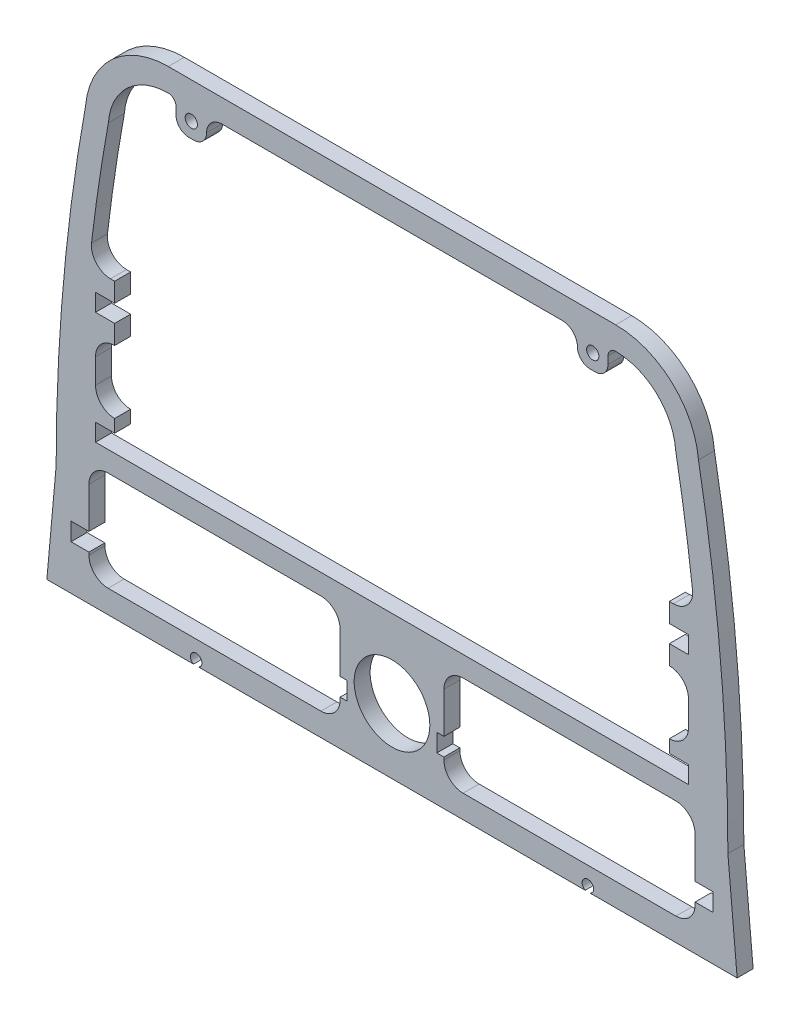
from build123d import *

# Parameters (mm, degrees)
SKETCH1_R           = 3.7592
SKETCH1_R_2         = 0.6096
BOSS_EXTRUDE1_DEPTH = 1.5875
FILLET1_R           = 1.905
FILLET2_R           = 1.905


with BuildPart() as part:
    # Sketch1 → Boss-Extrude1 (new body)
    with BuildSketch(Plane.XY):
        with BuildLine():
            Line((34.29, -22.225), (33.367605666, -11.9888))
            ThreePointArc((33.367605666, -11.9888), (32.635899737, 4.284200971), (30.44668746, 20.425864572))
            ThreePointArc((30.44668746, 20.425864572), (27.794074787, 25.778474462), (22.225, 27.94))
            Line((22.225, 27.94), (-22.225, 27.94))
            ThreePointArc((-22.225, 27.94), (-27.794074787, 25.778474462), (-30.44668746, 20.425864572))
            ThreePointArc((-30.44668746, 20.425864572), (-32.635899737, 4.284200971), (-33.367605666, -11.9888))
            Line((-33.367605666, -11.9888), (-34.29, -22.225))
            Line((-34.29, -22.225), (-19.719346062, -22.225))
            ThreePointArc((-19.719346062, -22.225), (-19.755004666, -21.229024189), (-18.886028855, -21.717))
            ThreePointArc((-18.886028855, -21.717), (-18.969553044, -22.014475811), (-19.195711648, -22.225))
            Line((-19.195711648, -22.225), (19.195711648, -22.225))
            ThreePointArc((19.195711648, -22.225), (19.160053044, -21.229024189), (20.029028855, -21.717))
            ThreePointArc((20.029028855, -21.717), (19.945504666, -22.014475811), (19.719346062, -22.225))
            Line((19.719346062, -22.225), (34.29, -22.225))
        make_face()
        Polygon((-5.1562, -19.939), (-30.110080889, -19.939), (-30.110080889, -17.78), (-31.888080889, -17.78), (-31.888080889, -16.002), (-30.110080889, -16.002), (-30.110080889, -10.033), (-5.1562, -10.033), (-5.1562, -16.002), (-4.456080889, -16.002), (-4.456080889, -17.78), (-5.1562, -17.78), align=None, mode=Mode.SUBTRACT)
        with Locations((0, -15.748)):
            Circle(SKETCH1_R, mode=Mode.SUBTRACT)
        Polygon((5.1562, -19.939), (5.1562, -17.78), (4.456080889, -17.78), (4.456080889, -16.002), (5.1562, -16.002), (5.1562, -10.033), (30.110080889, -10.033), (30.110080889, -16.002), (31.888080889, -16.002), (31.888080889, -17.78), (30.110080889, -17.78), (30.110080889, -19.939), align=None, mode=Mode.SUBTRACT)
        with BuildLine():
            Line((-16.907947674, 25.654), (16.907947674, 25.654))
            ThreePointArc((16.907947674, 25.654), (17.978031977, 25.210756569), (18.421275408, 24.140672267))
            Line((18.421275408, 24.140672267), (18.421275408, 24.136275408))
            ThreePointArc((18.421275408, 24.136275408), (18.793249795, 23.238249795), (19.691275408, 22.866275408))
            Line((19.691275408, 22.866275408), (20.186724592, 22.866275408))
            ThreePointArc((20.186724592, 22.866275408), (21.084750205, 23.238249795), (21.456724592, 24.136275408))
            Line((21.456724592, 24.136275408), (21.456724592, 24.871259676))
            ThreePointArc((21.456724592, 24.871259676), (21.686749328, 25.425496663), (22.24162483, 25.653976848))
            ThreePointArc((22.24162483, 25.653976848), (26.292824304, 24.053268127), (28.177671702, 20.126203591))
            ThreePointArc((28.177671702, 20.126203591), (29.260117929, 13.484694907), (30.092217203, 6.8072))
            Line((30.092217203, 6.8072), (27.552217203, 6.8072))
            Line((27.552217203, 6.8072), (27.552217203, 4.9022))
            Line((27.552217203, 4.9022), (29.457217203, 4.9022))
            Line((29.457217203, 4.9022), (29.457217203, 3.175))
            Line((29.457217203, 3.175), (27.552217203, 3.175))
            Line((27.552217203, 3.175), (27.552217203, 1.27))
            Line((27.552217203, 1.27), (29.457217203, 1.27))
            Line((29.457217203, 1.27), (29.457217203, -5.0038))
            Line((29.457217203, -5.0038), (27.552217203, -5.0038))
            Line((27.552217203, -5.0038), (27.552217203, -6.2738))
            Line((27.552217203, -6.2738), (29.457217203, -6.2738))
            Line((29.457217203, -6.2738), (29.457217203, -8.001))
            Line((29.457217203, -8.001), (-29.457217203, -8.001))
            Line((-29.457217203, -8.001), (-29.457217203, -6.2738))
            Line((-29.457217203, -6.2738), (-27.552217203, -6.2738))
            Line((-27.552217203, -6.2738), (-27.552217203, -5.0038))
            Line((-27.552217203, -5.0038), (-29.457217203, -5.0038))
            Line((-29.457217203, -5.0038), (-29.457217203, 1.27))
            Line((-29.457217203, 1.27), (-27.552217203, 1.27))
            Line((-27.552217203, 1.27), (-27.552217203, 3.175))
            Line((-27.552217203, 3.175), (-29.457217203, 3.175))
            Line((-29.457217203, 3.175), (-29.457217203, 4.9022))
            Line((-29.457217203, 4.9022), (-27.552217203, 4.9022))
            Line((-27.552217203, 4.9022), (-27.552217203, 6.8072))
            Line((-27.552217203, 6.8072), (-30.092217203, 6.8072))
            ThreePointArc((-30.092217203, 6.8072), (-29.260117929, 13.484694907), (-28.177671702, 20.126203591))
            ThreePointArc((-28.177671702, 20.126203591), (-26.292824304, 24.053268127), (-22.24162483, 25.653976848))
            ThreePointArc((-22.24162483, 25.653976848), (-21.686749328, 25.425496663), (-21.456724592, 24.871259676))
            Line((-21.456724592, 24.871259676), (-21.456724592, 24.136275408))
            ThreePointArc((-21.456724592, 24.136275408), (-21.084750205, 23.238249795), (-20.186724592, 22.866275408))
            Line((-20.186724592, 22.866275408), (-19.691275408, 22.866275408))
            ThreePointArc((-19.691275408, 22.866275408), (-18.793249795, 23.238249795), (-18.421275408, 24.136275408))
            Line((-18.421275408, 24.136275408), (-18.421275408, 24.140672267))
            ThreePointArc((-18.421275408, 24.140672267), (-17.978031977, 25.210756569), (-16.907947674, 25.654))
        make_face(mode=Mode.SUBTRACT)
        with Locations((-19.939, 24.384)):
            Circle(SKETCH1_R_2, mode=Mode.SUBTRACT)
        with Locations((19.939, 24.384)):
            Circle(SKETCH1_R_2, mode=Mode.SUBTRACT)
    extrude(amount=BOSS_EXTRUDE1_DEPTH)

    # Fillet1
    fillet1_edges = [part.edges().sort_by_distance(p)[0] for p in [
        (5.1562, -19.939, 0.79375),
        (30.110080889, -19.939, 0.79375),
        (30.110080889, -10.033, 0.79375),
        (5.1562, -10.033, 0.79375),
        (-5.1562, -19.939, 0.79375),
        (-5.1562, -10.033, 0.79375),
        (-30.110080889, -10.033, 0.79375),
        (-30.110080889, -19.939, 0.79375),
    ]]
    fillet(fillet1_edges, radius=FILLET1_R)

    # Fillet2
    fillet2_edges = [part.edges().sort_by_distance(p)[0] for p in [
        (-29.457217203, 1.27, 0.79375),
        (-29.457217203, -5.0038, 0.79375),
        (-30.092217203, 6.8072, 0.79375),
        (29.457217203, -5.0038, 0.79375),
        (29.457217203, 1.27, 0.79375),
        (30.092217203, 6.8072, 0.79375),
    ]]
    fillet(fillet2_edges, radius=FILLET2_R - 0.0001)  # a hair under: the kernel refuses the full size


solid = part.part
